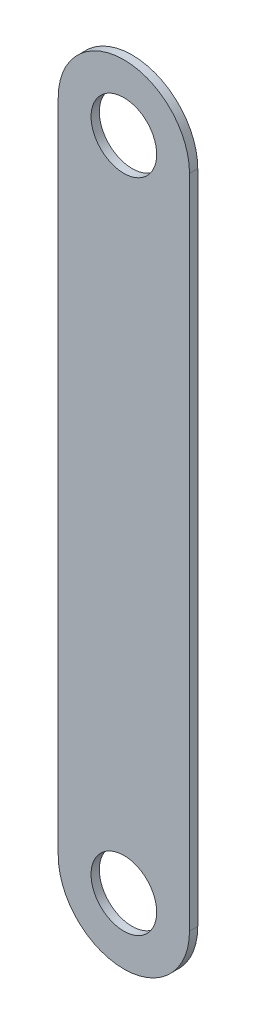
from build123d import *

# Parameters (mm, degrees)
SKETCH1_R           = 6.35
BOSS_EXTRUDE1_DEPTH = 1.6002


with BuildPart() as part:
    # Sketch1 → Boss-Extrude1 (new body)
    with BuildSketch(Plane.XY):
        with BuildLine():
            Line((-12.7, 0), (-12.7, 127))
            ThreePointArc((-12.7, 127), (0, 139.7), (12.7, 127))
            Line((12.7, 127), (12.7, 0))
            ThreePointArc((12.7, 0), (0, -12.7), (-12.7, 0))
        make_face()
        Circle(SKETCH1_R, mode=Mode.SUBTRACT)
        with Locations((0, 127)):
            Circle(SKETCH1_R, mode=Mode.SUBTRACT)
    extrude(amount=BOSS_EXTRUDE1_DEPTH)


solid = part.part
